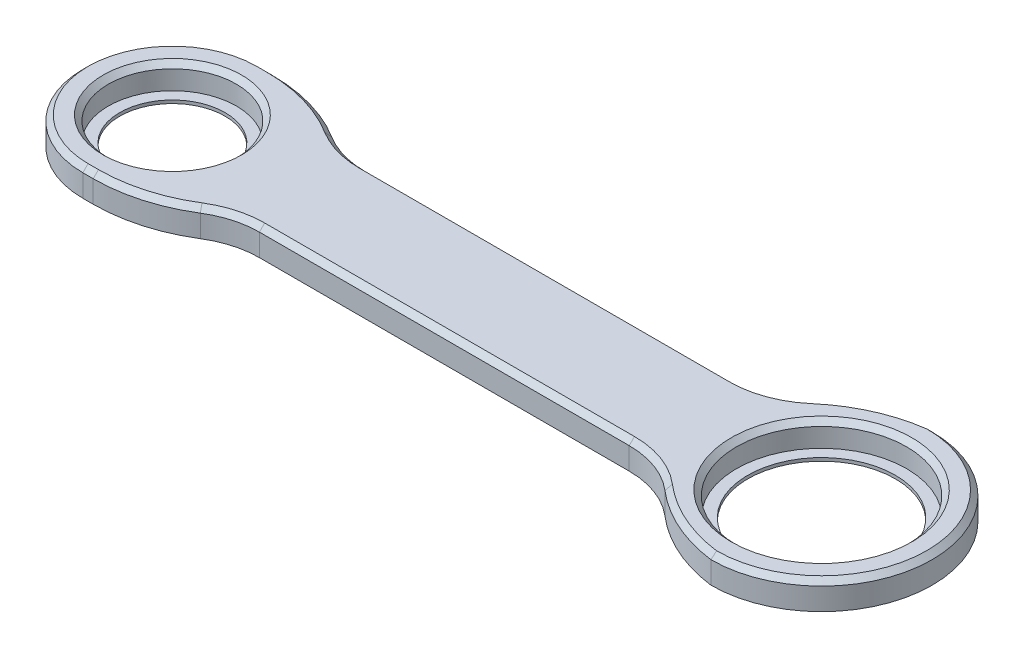
from build123d import *

# Parameters (mm, degrees)
SKETCH1_R           = 12.15
SKETCH1_R_2         = 16.15
BOSS_EXTRUDE1_DEPTH = 5.2
CUT_EXTRUDE1_DEPTH  = 86.410366028
FILLET1_R           = 30
CHAMFER1_SIZE       = 1
SKETCH2_R           = 14.75534968
SKETCH2_R_2         = 10
SKETCH2_R_3         = 19.025242353
SKETCH2_R_4         = 14
BOSS_EXTRUDE2_DEPTH = 0.6


with BuildPart() as part:
    # Sketch1 → Boss-Extrude1 (new body)
    with BuildSketch(Plane(origin=(0, 0, 0), x_dir=(1, 0, 0), z_dir=(0, 1, 0))):
        with BuildLine():
            Line((50.6952797, -21), (61.625, -21))
            ThreePointArc((61.625, -21), (82.625, 0), (61.625, 21))
            Line((61.625, 21), (50.6952797, 21))
            ThreePointArc((50.6952797, 21), (44.646090821, 13.026866227), (35.106613419, 10))
            Line((35.106613419, 10), (-35.106613419, 10))
            ThreePointArc((-35.106613419, 10), (-44.646090821, 13.026866227), (-50.6952797, 21))
            Line((-50.6952797, 21), (-61.625, 21))
            ThreePointArc((-61.625, 21), (-82.625, 0), (-61.625, -21))
            Line((-61.625, -21), (-50.6952797, -21))
            ThreePointArc((-50.6952797, -21), (-44.646090821, -13.026866227), (-35.106613419, -10))
            Line((-35.106613419, -10), (35.106613419, -10))
            ThreePointArc((35.106613419, -10), (44.646090821, -13.026866227), (50.6952797, -21))
        make_face()
        with Locations(Location((-61.625, 0, 0), (0, 0, 270))):
            Circle(SKETCH1_R, mode=Mode.SUBTRACT)
        with Locations(Location((61.625, 0, 0), (0, 0, 270))):
            Circle(SKETCH1_R_2, mode=Mode.SUBTRACT)
    extrude(amount=BOSS_EXTRUDE1_DEPTH)

    # Sketch4 → Cut-Extrude1 (cut, through all)
    with BuildSketch(Plane(origin=(0, 5.2, 0), x_dir=(1, 0, 0), z_dir=(0, 1, 0))):
        with BuildLine():
            Line((-61.625, 17), (-38.970543198, 17))
            Line((-38.970543198, 17), (-43.407950199, 33.342917206))
            Line((-43.407950199, 33.342917206), (-92.984497382, 23.090976894))
            Line((-92.984497382, 23.090976894), (-92.984497382, -9.501012459))
            Line((-92.984497382, -9.501012459), (-86.710921967, -27.097626428))
            Line((-86.710921967, -27.097626428), (-50.736883487, -31.973137348))
            Line((-50.736883487, -31.973137348), (-37.899444956, -29.584754809))
            Line((-37.899444956, -29.584754809), (-38.970543198, -17))
            Line((-38.970543198, -17), (-61.625, -17))
            ThreePointArc((-61.625, -17), (-78.625, 0), (-61.625, 17))
        make_face()
    extrude(amount=-CUT_EXTRUDE1_DEPTH, mode=Mode.SUBTRACT)

    # Fillet1
    # the kernel refuses this fillet: 30 mm, written as the material it takes off along each edge
    with BuildSketch(Plane(origin=(50.6952797, -27.324300751, -21), x_dir=(-0.5657553203908781, 0, 0.824573172889717), z_dir=(0, 1, 0))) as fillet1_piece_1:
        with BuildLine():
            CenterArc((16.192535549, 28.995119506), FILLET1_R, 221.766169003, 33.362358022)
            Line((-6.18354741, 9.012354147), (-6.631069069, 8.61269884))
            ThreePointArc((-6.631069069, 8.61269884), (-3.586517609, 4.166723881), (-0.494743904, -0.339453192))
            Line((-0.494743904, -0.339453192), (0.153990967, -0.57990239))
            ThreePointArc((0.153990967, -0.57990239), (4.246493598, -0.04578326), (8.338996228, -0.57990239))
            Line((8.338996228, -0.57990239), (8.492987195, 0))
        make_face()
    extrude(amount=59.848601502, mode=Mode.SUBTRACT)
    with BuildSketch(Plane(origin=(50.6952797, -27.324300751, 21), x_dir=(1, 0, 0), z_dir=(0, 1, 0))) as fillet1_piece_2:
        with BuildLine():
            CenterArc((14.747584551, 29.756073541), FILLET1_R, 229.326231532, 33.362358022)
            Line((-4.804952692, 7.003089399), (-5.196003436, 6.548029716))
            ThreePointArc((-5.196003436, 6.548029716), (-2.440227994, 3.475642576), (-0.565293163, -0.201106042))
            Line((-0.565293163, -0.201106042), (0, -0.6))
            ThreePointArc((0, -0.6), (5.46486015, -0.6), (10.853363015, -0.595121471))
            Line((10.853363015, -0.595121471), (10.9297203, 0))
        make_face()
    extrude(amount=59.848601502, mode=Mode.SUBTRACT)
    with BuildSketch(Plane(origin=(-48.621069029, 32.785704602, -17), x_dir=(-1, 0, 0), z_dir=(0, -1, 0))) as fillet1_piece_3:
        with BuildLine():
            CenterArc((11.034281841, -30), FILLET1_R, 90, 31.830687787)
            Line((-4.788045906, -4.511690039), (-5.104492461, -4.00192384))
            ThreePointArc((-5.104492461, -4.00192384), (-2.578998673, -2.059538928), (-0.490075881, 0.34615839))
            Line((-0.490075881, 0.34615839), (0, 0.6))
            Line((0, 0.6), (11.034281841, 0.6))
            Line((11.034281841, 0.6), (11.034281841, 0))
        make_face()
    extrude(amount=60.371409204, mode=Mode.SUBTRACT)
    with BuildSketch(Plane(origin=(-48.621069029, 32.785704602, 17), x_dir=(0.7277982616759969, 0, -0.6857912877117915), z_dir=(0, -1, 0))) as fillet1_piece_4:
        with BuildLine():
            CenterArc((12.543007489, -29.401162203), FILLET1_R, 101.467181472, 31.830687787)
            Line((-8.030731143, -7.567214353), (-8.442205915, -7.130535396))
            Line((-8.442205915, -7.130535396), (-0.411474773, 0.436678957))
            Line((-0.411474773, 0.436678957), (0.119283966, 0.588023244))
            ThreePointArc((0.119283966, 0.588023244), (3.289404605, 0.269725969), (6.459525243, 0.588023244))
            Line((6.459525243, 0.588023244), (6.578809209, 0))
        make_face()
    extrude(amount=60.371409204, mode=Mode.SUBTRACT)

    # Chamfer1
    # the kernel refuses this chamfer: 1 mm, written as the material it takes off along each edge
    with BuildSketch(Plane(origin=(61.625, 5.2, 0), x_dir=(-0.12235070165055927, 0, 0.9924869297908239), z_dir=(-0.9924869297908239, 0, -0.12235070165055927))) as chamfer1_piece_1:
        Polygon((21 - CHAMFER1_SIZE, 0), (21, -CHAMFER1_SIZE), (21, 0), align=None)
    revolve(axis=Axis((61.625, 5.2, 0), (0, 1, 0)), revolution_arc=194.055575488, mode=Mode.SUBTRACT)
    with BuildSketch(Plane(origin=(35.106613419, 5.2, -26.545750746), x_dir=(0.6517512414299695, 0, 0.7584328047325575), z_dir=(0.7584328047325575, 0, -0.6517512414299695))) as chamfer1_piece_2:
        Polygon((16.545750746 + CHAMFER1_SIZE, 0), (16.545750746, CHAMFER1_SIZE), (16.545750746, 0), align=None)
    revolve(axis=Axis((35.106613419, 5.2, -26.545750746), (0, -1, 0)), revolution_arc=40.673768468, mode=Mode.SUBTRACT)
    with BuildSketch(Plane(origin=(35.106613419, 5.2, -10), x_dir=(0, 0, 1), z_dir=(-1, 0, 0))) as chamfer1_piece_3:
        Polygon((CHAMFER1_SIZE, 0), (0, -CHAMFER1_SIZE), (0, 0), align=None)
    extrude(amount=70.213226838, mode=Mode.SUBTRACT)
    with BuildSketch(Plane(origin=(-61.625, 5.2, 0), x_dir=(0, 0, 1), z_dir=(1, 0, 0))) as chamfer1_piece_4:
        Polygon((17 - CHAMFER1_SIZE, 0), (17, CHAMFER1_SIZE), (17, 0), align=None)
    revolve(axis=Axis((-61.625, 5.2, 0), (0, -1, 0)), revolution_arc=180, mode=Mode.SUBTRACT)
    with BuildSketch(Plane(origin=(-61.625, 5.2, -17), x_dir=(0, 0, 1), z_dir=(1, 0, 0)), Plane(origin=(-59.65535087, 5.2, 17), x_dir=(0, 0, -1), z_dir=(-1, 0, 0))) as chamfer1_piece_5:
        Polygon((CHAMFER1_SIZE, 0), (0, CHAMFER1_SIZE), (0, 0), align=None)
    extrude(amount=1.96964913, mode=Mode.SUBTRACT)
    with BuildSketch(Plane(origin=(-35.106613419, 5.2, 26.545750746), x_dir=(-0.5274109249013418, 0, -0.8496103320315208), z_dir=(-0.8496103320315208, 0, 0.5274109249013418))) as chamfer1_piece_6:
        Polygon((16.545750746, CHAMFER1_SIZE), (16.545750746 + CHAMFER1_SIZE, 0), (16.545750746, 0), align=None)
    revolve(axis=Axis((-35.106613419, 5.2, 26.545750746), (0, -1, 0)), revolution_arc=31.830687787, mode=Mode.SUBTRACT)
    with BuildSketch(Plane(origin=(-35.106613419, 5.2, 10), x_dir=(0, -1, 0), z_dir=(1, 0, 0))) as chamfer1_piece_7:
        Polygon((CHAMFER1_SIZE, 0), (0, CHAMFER1_SIZE), (0, 0), align=None)
    extrude(amount=70.213226838, mode=Mode.SUBTRACT)
    with BuildSketch(Plane(origin=(-61.625, 5.2, 0), x_dir=(0, 0, 1), z_dir=(-1, 0, 0))) as chamfer1_piece_8:
        Polygon((12.15 + CHAMFER1_SIZE, 0), (12.15, -CHAMFER1_SIZE), (12.15, 0), align=None)
    revolve(axis=Axis((-61.625, 5.2, 0), (0, 1, 0)), mode=Mode.SUBTRACT)
    with BuildSketch(Plane(origin=(61.625, 5.2, 0), x_dir=(0, 0, 1), z_dir=(-1, 0, 0))) as chamfer1_piece_9:
        Polygon((16.15 + CHAMFER1_SIZE, 0), (16.15, -CHAMFER1_SIZE), (16.15, 0), align=None)
    revolve(axis=Axis((61.625, 5.2, 0), (0, 1, 0)), mode=Mode.SUBTRACT)
    with BuildSketch(Plane(origin=(-35.106613419, 5.2, -26.545750746), x_dir=(0, 0, 1), z_dir=(1, 0, 0))) as chamfer1_piece_10:
        Polygon((16.545750746 + CHAMFER1_SIZE, 0), (16.545750746, CHAMFER1_SIZE), (16.545750746, 0), align=None)
    revolve(axis=Axis((-35.106613419, 5.2, -26.545750746), (0, -1, 0)), revolution_arc=31.830687787, mode=Mode.SUBTRACT)
    with BuildSketch(Plane(origin=(35.106613419, 5.2, 26.545750746), x_dir=(0, 0, -1), z_dir=(-1, 0, 0))) as chamfer1_piece_11:
        Polygon((16.545750746 + CHAMFER1_SIZE, 0), (16.545750746, CHAMFER1_SIZE), (16.545750746, 0), align=None)
    revolve(axis=Axis((35.106613419, 5.2, 26.545750746), (0, -1, 0)), revolution_arc=40.673768468, mode=Mode.SUBTRACT)
    with BuildSketch(Plane(origin=(65.442864251, 5.2, -8.756073541), x_dir=(0.1292120287500912, 0, 0.9916169883711581), z_dir=(0.9916169883711581, 0, -0.1292120287500912))) as chamfer1_piece_12:
        Polygon((30 - CHAMFER1_SIZE, 0), (30, CHAMFER1_SIZE), (30, 0), align=None)
    revolve(axis=Axis((65.442864251, 5.2, -8.756073541), (0, -1, 0)), revolution_arc=48.097829324, mode=Mode.SUBTRACT)
    with BuildSketch(Plane(origin=(65.442864251, 5.2, 8.756073541), x_dir=(-0.6517512414300072, 0, -0.7584328047325251), z_dir=(-0.7584328047325251, 0, 0.6517512414300072))) as chamfer1_piece_13:
        Polygon((30 - CHAMFER1_SIZE, 0), (30, CHAMFER1_SIZE), (30, 0), align=None)
    revolve(axis=Axis((65.442864251, 5.2, 8.756073541), (0, -1, 0)), revolution_arc=48.097829324, mode=Mode.SUBTRACT)
    with BuildSketch(Plane(origin=(-59.65535087, 5.2, -13), x_dir=(0, 0, 1), z_dir=(-1, 0, 0))) as chamfer1_piece_14:
        Polygon((30 - CHAMFER1_SIZE, 0), (30, -CHAMFER1_SIZE), (30, 0), align=None)
    revolve(axis=Axis((-59.65535087, 5.2, -13), (0, 1, 0)), revolution_arc=31.830687787, mode=Mode.SUBTRACT)
    with BuildSketch(Plane(origin=(-59.65535087, 5.2, 13), x_dir=(0.5274109249013516, 0, -0.8496103320315149), z_dir=(0.8496103320315149, 0, 0.5274109249013516))) as chamfer1_piece_15:
        Polygon((30 - CHAMFER1_SIZE, 0), (30, -CHAMFER1_SIZE), (30, 0), align=None)
    revolve(axis=Axis((-59.65535087, 5.2, 13), (0, 1, 0)), revolution_arc=31.830687787, mode=Mode.SUBTRACT)

    # Sketch2 → Boss-Extrude2 (add)
    # profile 1 of 2: a face of its own
    with BuildSketch(Plane.XZ):
        with Locations((-61.625, 0)):
            Circle(SKETCH2_R)
        with Locations(Location((-61.625, 0, 0), (0, 0, 270))):
            Circle(SKETCH2_R_2, mode=Mode.SUBTRACT)
    # profile 2 of 2: a face of its own
    with BuildSketch(Plane.XZ):
        with Locations((61.625, 0)):
            Circle(SKETCH2_R_3)
        with Locations(Location((61.625, 0, 0), (0, 0, 270))):
            Circle(SKETCH2_R_4, mode=Mode.SUBTRACT)
    extrude(amount=-BOSS_EXTRUDE2_DEPTH)


solid = part.part
